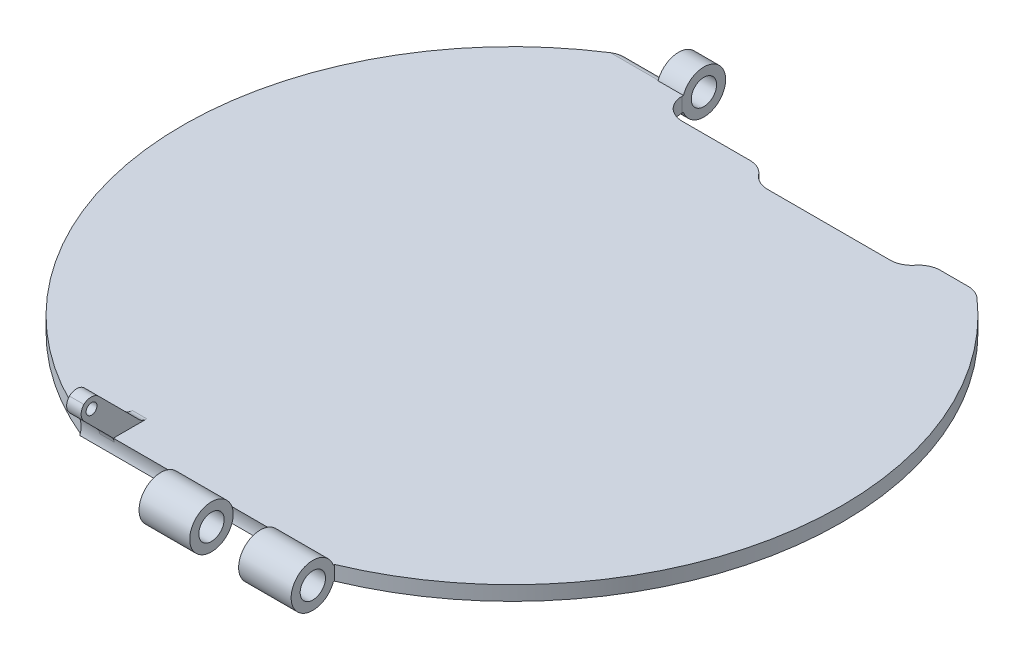
from build123d import *

# Parameters (mm, degrees)
BOSS_EXTRUDE1_DEPTH            = 2
BOSS_EXTRUDE2_DEPTH            = 17.5
BOSS_EXTRUDE2_DEPTH_BACK       = 17.5
SKETCH2_R                      = 1.7500000000000036
SKETCH3_R                      = 2.999999999999994
CUT_EXTRUDE1_DEPTH             = 6.75
CUT_EXTRUDE2_DEPTH             = 2
BOSS_EXTRUDE4_DEPTH            = 3
BOSS_EXTRUDE4_DEPTH_BACK       = 0.5
SKETCH6_R                      = 1.7500000000000036
CUT_EXTRUDE3_DEPTH             = 77.9415362466854
FILLET1_R                      = 1
SKETCH7_W                      = 9
SKETCH7_H                      = 6
CUT_EXTRUDE4_DEPTH             = 2
FILLET2_R                      = 3
FILLET3_R                      = 3
CUT_EXTRUDE5_REACH             = 78.455
SKETCH10_R                     = 2.999999999999994
CUT_EXTRUDE5_DIRECTION_2_REACH = 78.455
BOSS_EXTRUDE6_DEPTH            = 1
BOSS_EXTRUDE6_DEPTH_BACK       = 1
SKETCH11_R                     = 0.7499999999999987
FILLET5_R                      = 1.5


# Some blends are built 0.0001 mm under size
with BuildPart() as part:
    # Sketch1 → Boss-Extrude1 (new body)
    with BuildSketch(Plane(origin=(0, 0, 0), x_dir=(1, 0, 0), z_dir=(0, 1, 0))):
        with BuildLine():
            Line((-17.499999999999993, -42), (17.499999999999993, -42))
            ThreePointArc((17.499999999999993, -42), (45.5, 1.01e-14), (17.499999999999975, 42.00000000000001))
            Line((17.499999999999975, 42.00000000000001), (-17.499999999999975, 42.00000000000001))
            ThreePointArc((-17.499999999999975, 42.00000000000001), (-45.5, 5.57e-15), (-17.499999999999993, -42))
        make_face()
    extrude(amount=BOSS_EXTRUDE1_DEPTH)

    # Sketch2 → Boss-Extrude2 (add, two sides: drawn at the far end of the back side and taken through both)
    with BuildSketch(Plane(origin=(0, 0, 0), x_dir=(0, 0, -1), z_dir=(1, 0, 0)).offset(-BOSS_EXTRUDE2_DEPTH_BACK)):
        with BuildLine():
            Line((-42, 0), (-42.171572875253815, 0))
            ThreePointArc((-42.171572875253815, 0), (-48.00000000000001, 1.0000000000000004), (-42.171572875253815, 2))
            Line((-42.171572875253815, 2), (-42, 2))
            Line((-42, 2), (-42, 1))
            Line((-42, 1), (-42, 0))
        make_face()
        with Locations((-45.00000000000001, 1)):
            Circle(SKETCH2_R, mode=Mode.SUBTRACT)
    extrude(amount=BOSS_EXTRUDE2_DEPTH + BOSS_EXTRUDE2_DEPTH_BACK)

    # Sketch3 → Cut-Extrude1 (cut)
    with BuildSketch(Plane(origin=(3.5, 0, 0), x_dir=(0, 0, -1), z_dir=(1, 0, 0))):
        with Locations((-45.00000000000001, 1)):
            Circle(SKETCH3_R)
    cut_extrude1 = extrude(amount=CUT_EXTRUDE1_DEPTH, mode=Mode.SUBTRACT)

    # Mirror1: Cut-Extrude1 across plane
    add(cut_extrude1.mirror(Plane(origin=(0, 0, 0), x_dir=(0, 0, 1), z_dir=(1, 0, 0))), mode=Mode.SUBTRACT)

    # Sketch4 → Cut-Extrude2 (cut)
    with BuildSketch(Plane(origin=(0, 2, 0), x_dir=(1, 0, 0), z_dir=(0, 1, 0))):
        Polygon((0.7499999999999764, 42.00000000000001), (21.249999999999982, 42.00000000000001), (21.24999999999998, 32.75000000000001), (0.7499999999999775, 32.75000000000001), (0.7499999999999781, 35.00000000000001), (-17.50000000000002, 35.00000000000001), (-17.50000000000002, 42.00000000000001), align=None)
    extrude(amount=-CUT_EXTRUDE2_DEPTH, mode=Mode.SUBTRACT)

    # Sketch5 → Boss-Extrude4 (add, two sides: drawn at the far end of the back side and taken through both)
    with BuildSketch(Plane(origin=(-17.50000000000002, 0, 0), x_dir=(0, 0, -1), z_dir=(1, 0, 0)).offset(-BOSS_EXTRUDE4_DEPTH_BACK)):
        with BuildLine():
            Line((35.00000000000001, 1), (35.00000000000001, 2))
            Line((35.00000000000001, 2), (38.171572875253815, 2))
            ThreePointArc((38.171572875253815, 2), (44.00000000000001, 1), (38.171572875253815, 0))
            Line((38.171572875253815, 0), (35.00000000000001, 0))
            Line((35.00000000000001, 0), (35.00000000000001, 1))
        make_face()
    extrude(amount=BOSS_EXTRUDE4_DEPTH + BOSS_EXTRUDE4_DEPTH_BACK)

    # Sketch6 → Cut-Extrude3 (cut, through all)
    with BuildSketch(Plane(origin=(-14.500000000000023, 0, 0), x_dir=(0, 0, -1), z_dir=(1, 0, 0))):
        with Locations((41.00000000000001, 1)):
            Circle(SKETCH6_R)
    extrude(amount=-CUT_EXTRUDE3_DEPTH, mode=Mode.SUBTRACT)

    # Fillet1
    fillet1_edges = [part.edges().sort_by_distance(p)[0] for p in [
        (-20.23555777714238, 0, -39.563859338365496),
        (-20.23555777714238, 2, -39.563859338365496),
    ]]
    fillet(fillet1_edges, radius=FILLET1_R - 0.0001)  # a hair under: the kernel refuses the full size

    # Sketch7 → Cut-Extrude4 (cut)
    with BuildSketch(Plane(origin=(0, 2, 0), x_dir=(1, 0, 0), z_dir=(0, 1, 0))):
        with Locations((24.749999999999975, 38.00000000000001)):
            Rectangle(SKETCH7_W, SKETCH7_H)
    extrude(amount=-CUT_EXTRUDE4_DEPTH, mode=Mode.SUBTRACT)

    # Fillet2
    # the kernel refuses this fillet: 3 mm, written as the material it adds along each edge
    with BuildSketch(Plane(origin=(-14.500000000000021, 0, -35.00000000000001), x_dir=(0, 0, -1), z_dir=(0, 1, 0))) as fillet2_piece_1:
        with BuildLine():
            CenterArc((FILLET2_R, -FILLET2_R), FILLET2_R, 90, 90)
            Line((0, -FILLET2_R), (0, 0))
            Line((0, 0), (FILLET2_R, 0))
        make_face()
    extrude(amount=2)
    # the kernel refuses this fillet: 3 mm, written as the material it takes off along each edge
    with BuildSketch(Plane(origin=(29.07318352021326, 4.856917413714078, -35.00000000000001), x_dir=(-1, 0, 0), z_dir=(0, -1, 0))) as fillet2_2_piece_1:
        with BuildLine():
            CenterArc((1.1044509783192602, -3), FILLET2_R, 90, 41.154201960072044)
            ThreePointArc((-0.8698124952261921, -0.7411764705882291), (-0.43723324041952694, -0.3678573776648406), (0, 0))
            Line((0, 0), (1.1044509783192602, 0))
        make_face()
    extrude(amount=7.7138348274281565, mode=Mode.SUBTRACT)
    with BuildSketch(Plane(origin=(21.24999999999998, -7.261843774138903, -35.00000000000001), x_dir=(0, 0, 1), z_dir=(0, 1, 0))) as fillet2_2_piece_2:
        with BuildLine():
            CenterArc((3, 2.904737509655561), FILLET2_R, 180, 75.52248781407008)
            Line((0, 2.904737509655561), (0, 0))
            Line((0, 0), (2.25, 0))
        make_face()
    extrude(amount=16.523687548277806, mode=Mode.SUBTRACT)
    with BuildSketch(Plane(origin=(0.7499999999999781, 9.261843774138908, -35.00000000000001), x_dir=(-1, 0, 0), z_dir=(0, -1, 0))) as fillet2_2_piece_3:
        with BuildLine():
            CenterArc((2.9047375096555634, -3), FILLET2_R, 90, 75.5224878140701)
            Line((7.8e-16, -2.25), (0, 0))
            Line((0, 0), (2.9047375096555634, 0))
        make_face()
    extrude(amount=16.523687548277817, mode=Mode.SUBTRACT)

    # Fillet3
    fillet3_edges = [part.edges().sort_by_distance(p)[0] for p in [
        (21.24999999999998, 1, -32.75000000000001),
        (0.7499999999999775, 1, -32.75000000000001),
    ]]
    fillet(fillet3_edges, radius=FILLET3_R)

    # Cut-Extrude5: up to this face of the body (flat: up to its plane)
    cut_extrude5_end = Plane(part.part.faces().sort_by_distance((-10.25, 1, 42.084852814))[0])
    # Sketch10 → Cut-Extrude5 (cut, up to the picked face)
    with BuildSketch(Plane.ZY.offset(13.874999999999995), mode=Mode.PRIVATE) as cut_extrude5_sk1:
        with Locations((45.00000000000001, 1)):
            Circle(SKETCH10_R)
    cut_extrude5_tool1 = split(extrude(cut_extrude5_sk1.sketch, amount=-CUT_EXTRUDE5_REACH, mode=Mode.PRIVATE), bisect_by=cut_extrude5_end, keep=Keep.BOTH, mode=Mode.PRIVATE)
    add(cut_extrude5_tool1.solids().sort_by(Axis((-13.875, 1, 45), (1, 0, 0)))[0], mode=Mode.SUBTRACT)

    # Cut-Extrude5 direction 2: up to this face of the body (flat: up to its plane)
    cut_extrude5_direction_2_end = Plane(part.part.faces().sort_by_distance((-17.5, 1.915147186, 42.085786438))[0])
    # Sketch10 → Cut-Extrude5 direction 2 (cut, up to the picked face)
    with BuildSketch(Plane.ZY.offset(13.874999999999995), mode=Mode.PRIVATE) as cut_extrude5_direction_2_sk1:
        with Locations((45.00000000000001, 1)):
            Circle(SKETCH10_R)
    cut_extrude5_direction_2_tool1 = split(extrude(cut_extrude5_direction_2_sk1.sketch, amount=CUT_EXTRUDE5_DIRECTION_2_REACH, mode=Mode.PRIVATE), bisect_by=cut_extrude5_direction_2_end, keep=Keep.BOTH, mode=Mode.PRIVATE)
    add(cut_extrude5_direction_2_tool1.solids().sort_by(Axis((-13.875, 1, 45), (-1, 0, 0)))[0], mode=Mode.SUBTRACT)

    # Sketch11 → Boss-Extrude6 (add, two sides: drawn at the far end of the back side and taken through both)
    with BuildSketch(Plane.ZY.offset(13.874999999999995).offset(-BOSS_EXTRUDE6_DEPTH_BACK)):
        Polygon((38.171572875253815, 2), (45.24264068711927, 9.07106781186549), (47.242640687119284, 7.071067811865485), (42.171572875253815, 2), align=None)
        with Locations((45.18198051533946, 7.010407640085664)):
            Circle(SKETCH11_R, mode=Mode.SUBTRACT)
    extrude(amount=BOSS_EXTRUDE6_DEPTH + BOSS_EXTRUDE6_DEPTH_BACK)

    # Fillet5
    # the kernel refuses this fillet: 1.5 mm, written as the material it adds along each edge
    with BuildSketch(Plane(origin=(-12.874999999999995, 2, 42.171572875253815), x_dir=(0, -0.9701770324837726, -0.24239745386653885), z_dir=(-1, 0, 0))) as fillet5_piece_1:
        with BuildLine():
            CenterArc((0.42686024849732124, 1.4932362441747078), FILLET5_R, 239.02808334302642, 36.41505394843642)
            Line((-0.3450665643766781, 0.2071067811865567), (0, 0))
            ThreePointArc((0, 0), (0.284573498998202, -0.01352751165058759), (0.5691469979964033, 2e-17))
        make_face()
    extrude(amount=2)
    with BuildSketch(Plane(origin=(-12.874999999999995, 2, 38.171572875253815), x_dir=(0, 0, -1), z_dir=(-1, 0, 0))) as fillet5_piece_2:
        with BuildLine():
            CenterArc((FILLET5_R * 0.414213562373, -FILLET5_R), FILLET5_R, 90, 45.000000000000085)
            Line((-FILLET5_R * 0.292893218813, -FILLET5_R * 0.292893218813), (0, 0))
            Line((0, 0), (FILLET5_R * 0.414213562373, 0))
        make_face()
    extrude(amount=2)
    # the kernel refuses this fillet: 1.5 mm, written as the material it takes off along each edge
    with BuildSketch(Plane(origin=(-18.625000000000014, 7.071067811865485, 47.242640687119284), x_dir=(0, 0.7071067811865455, -0.7071067811865496), z_dir=(1, 0, 0))) as fillet5_2_piece_1:
        with BuildLine():
            CenterArc((FILLET5_R, -FILLET5_R), FILLET5_R, 89.9999999999999, 90.00000000000017)
            Line((4.98e-15, -FILLET5_R), (0, 0))
            Line((0, 0), (FILLET5_R, 2e-17))
        make_face()
    extrude(amount=9.500000000000039, mode=Mode.SUBTRACT)
    with BuildSketch(Plane(origin=(-18.62499999999999, 9.07106781186549, 45.24264068711927), x_dir=(0, -0.7071067811865499, -0.7071067811865451), z_dir=(1, 0, 0))) as fillet5_2_piece_2:
        with BuildLine():
            CenterArc((FILLET5_R, -FILLET5_R), FILLET5_R, 90.0000000000001, 89.99999999999984)
            Line((1.28e-15, -FILLET5_R), (0, 0))
            Line((0, 0), (FILLET5_R, 9e-17))
        make_face()
    extrude(amount=9.49999999999999, mode=Mode.SUBTRACT)


solid = part.part
